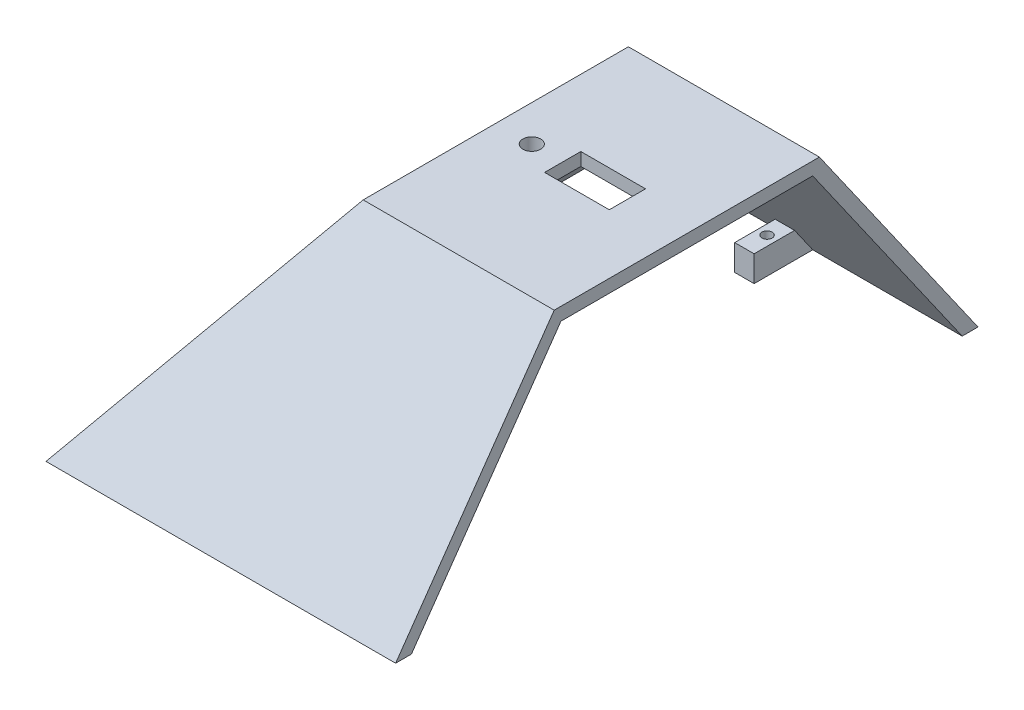
from build123d import *

# Parameters (mm, degrees)
CROQUIS1_W                        = 175.37
CROQUIS1_H                        = 180
SALIENTE_EXTRUIR1_DEPTH           = 70
CORTAR_EXTRUIR2_REACH             = 211.176
CORTAR_EXTRUIR1_REACH             = 214.105
VACIADO1_T                        = -4
CORTAR_EXTRUIR3_REACH             = 180.366
CORTAR_EXTRUIR5_REACH             = 145.836
CORTAR_EXTRUIR5_DIRECTION_2_REACH = 145.836
CORTAR_EXTRUIR8_REACH             = 145.836
CROQUIS12_W                       = 20
CROQUIS12_H                       = 11.2
CORTAR_EXTRUIR9_REACH             = 145.836
CROQUIS13_R                       = 2.75
SALIENTE_EXTRUIR2_REACH           = 194.971
CROQUIS15_W                       = 6
CROQUIS15_H                       = 8
CORTAR_EXTRUIR10_REACH            = 145.836
CROQUIS16_R                       = 1.585


with BuildPart() as part:
    # Croquis1 → Saliente-Extruir1 (new body)
    with BuildSketch(Plane(origin=(0, 0, 0), x_dir=(1, 0, 0), z_dir=(0, 1, 0))):
        Rectangle(CROQUIS1_W, CROQUIS1_H)
    extrude(amount=SALIENTE_EXTRUIR1_DEPTH)

    # Croquis3 → Cortar-Extruir2 (cut, up to next)
    with BuildSketch(Plane.ZY.offset(87.685), mode=Mode.PRIVATE) as cortar_extruir2_sk1:
        Polygon((-90, 0), (-90, 70), (-40.985472325, 70), align=None)
    cortar_extruir2_tool1 = extrude(cortar_extruir2_sk1.sketch, amount=-CORTAR_EXTRUIR2_REACH, mode=Mode.PRIVATE) & part.part
    # Croquis3 → Cortar-Extruir2 (cut, up to next)
    with BuildSketch(Plane.ZY.offset(87.685), mode=Mode.PRIVATE) as cortar_extruir2_sk2:
        Polygon((90, 0), (90, 70), (40.985472325, 70), align=None)
    cortar_extruir2_tool2 = extrude(cortar_extruir2_sk2.sketch, amount=-CORTAR_EXTRUIR2_REACH, mode=Mode.PRIVATE) & part.part
    add(cortar_extruir2_tool1.solids().sort_by_distance((-87.685, 46.666667, -73.661824))[0], mode=Mode.SUBTRACT)
    add(cortar_extruir2_tool2.solids().sort_by_distance((-87.685, 46.666667, 73.661824))[0], mode=Mode.SUBTRACT)

    # Croquis2 → Cortar-Extruir1 (cut, up to next)
    with BuildSketch(Plane.XY.offset(90), mode=Mode.PRIVATE) as cortar_extruir1_sk1:
        Polygon((-87.685, 70), (-38.670472325, 70), (-87.685, 0), align=None)
    cortar_extruir1_tool1 = extrude(cortar_extruir1_sk1.sketch, amount=-CORTAR_EXTRUIR1_REACH, mode=Mode.PRIVATE) & part.part
    # Croquis2 → Cortar-Extruir1 (cut, up to next)
    with BuildSketch(Plane.XY.offset(90), mode=Mode.PRIVATE) as cortar_extruir1_sk2:
        Polygon((87.685, 70), (38.670472325, 70), (87.685, 0), align=None)
    cortar_extruir1_tool2 = extrude(cortar_extruir1_sk2.sketch, amount=-CORTAR_EXTRUIR1_REACH, mode=Mode.PRIVATE) & part.part
    add(cortar_extruir1_tool1.solids().sort_by_distance((-71.346824, 46.666667, 90))[0], mode=Mode.SUBTRACT)
    add(cortar_extruir1_tool2.solids().sort_by_distance((71.346824, 46.666667, 90))[0], mode=Mode.SUBTRACT)

    # Vaciado1
    vaciado1_openings = [part.faces().sort_by_distance(p)[0] for p in [
        (0, 0, 0),
    ]]
    offset(amount=VACIADO1_T, openings=vaciado1_openings, kind=Kind.INTERSECTION)

    # Croquis4 → Cortar-Extruir3 (cut, up to next)
    with BuildSketch(Plane(origin=(60.39090645, 42.286167935, 0), x_dir=(0, 0, -1), z_dir=(0.819152044288995, 0.5735764363510417, 0)), mode=Mode.PRIVATE) as cortar_extruir3_sk1:
        Polygon((-90, -51.621879272), (-40.985472325, 33.832341942), (40.985472325, 33.832341942), (90, -51.621879272), align=None)
    cortar_extruir3_tool1 = extrude(cortar_extruir3_sk1.sketch, amount=-CORTAR_EXTRUIR3_REACH, mode=Mode.PRIVATE) & part.part
    add(cortar_extruir3_tool1.solids().sort_by_distance((68.549594, 30.634354, 0))[0], mode=Mode.SUBTRACT)

    # Croquis7 → Cortar-Extruir5 (cut, up to next)
    with BuildSketch(Plane.XY, mode=Mode.PRIVATE) as cortar_extruir5_sk1:
        Polygon((90, 0), (20.37, 0), (20.37, 70), (40.985472325, 70), align=None)
    cortar_extruir5_tool1 = extrude(cortar_extruir5_sk1.sketch, amount=-CORTAR_EXTRUIR5_REACH, mode=Mode.PRIVATE) & part.part
    add(cortar_extruir5_tool1.solids().sort_by_distance((45.149784, 28.663547, 0))[0], mode=Mode.SUBTRACT)

    # Croquis7 → Cortar-Extruir5 direction 2 (cut, up to next)
    with BuildSketch(Plane.XY, mode=Mode.PRIVATE) as cortar_extruir5_direction_2_sk1:
        Polygon((90, 0), (20.37, 0), (20.37, 70), (40.985472325, 70), align=None)
    cortar_extruir5_direction_2_tool1 = extrude(cortar_extruir5_direction_2_sk1.sketch, amount=CORTAR_EXTRUIR5_DIRECTION_2_REACH, mode=Mode.PRIVATE) & part.part
    add(cortar_extruir5_direction_2_tool1.solids().sort_by_distance((45.149784, 28.663547, 0))[0], mode=Mode.SUBTRACT)

    # Croquis12 → Cortar-Extruir8 (cut, up to next)
    with BuildSketch(Plane(origin=(0, 70, 0), x_dir=(1, 0, 0), z_dir=(0, 1, 0)), mode=Mode.PRIVATE) as cortar_extruir8_sk1:
        with Locations((-7.990472325, 0.000472325)):
            Rectangle(CROQUIS12_W, CROQUIS12_H)
    cortar_extruir8_tool1 = extrude(cortar_extruir8_sk1.sketch, amount=-CORTAR_EXTRUIR8_REACH, mode=Mode.PRIVATE) & part.part
    add(cortar_extruir8_tool1.solids().sort_by_distance((-7.990472, 70, -0.000472))[0], mode=Mode.SUBTRACT)

    # Croquis13 → Cortar-Extruir9 (cut, up to next)
    with BuildSketch(Plane(origin=(0, 70, 0), x_dir=(1, 0, 0), z_dir=(0, 1, 0)), mode=Mode.PRIVATE) as cortar_extruir9_sk1:
        with Locations((-27.546576138, 0)):
            Circle(CROQUIS13_R)
    cortar_extruir9_tool1 = extrude(cortar_extruir9_sk1.sketch, amount=-CORTAR_EXTRUIR9_REACH, mode=Mode.PRIVATE) & part.part
    add(cortar_extruir9_tool1.solids().sort_by_distance((-27.546576, 70, 0))[0], mode=Mode.SUBTRACT)

    # Croquis15 → Saliente-Extruir2 (add, up to next)
    with BuildSketch(Plane.XY.offset(67), mode=Mode.PRIVATE) as saliente_extruir2_sk1:
        with Locations((-28.829142533, 4)):
            Rectangle(CROQUIS15_W, CROQUIS15_H)
    saliente_extruir2_tool1 = extrude(saliente_extruir2_sk1.sketch, amount=SALIENTE_EXTRUIR2_REACH, mode=Mode.PRIVATE) - part.part
    saliente_extruir2 = saliente_extruir2_tool1.solids().sort_by_distance((-28.829143, 4, 67))[0]
    add(saliente_extruir2)

    # Croquis16 → Cortar-Extruir10 (cut, up to next)
    with BuildSketch(Plane(origin=(0, 0, 0), x_dir=(-1, 0, 0), z_dir=(0, -1, 0)), mode=Mode.PRIVATE) as cortar_extruir10_sk1:
        with Locations((28.829142533, -74)):
            Circle(CROQUIS16_R)
    cortar_extruir10_tool1 = extrude(cortar_extruir10_sk1.sketch, amount=-CORTAR_EXTRUIR10_REACH, mode=Mode.PRIVATE) & part.part
    cortar_extruir10 = cortar_extruir10_tool1.solids().sort_by_distance((-28.829143, 0, 74))[0]
    add(cortar_extruir10, mode=Mode.SUBTRACT)

    # Simetría1: Saliente-Extruir2, Cortar-Extruir10 across plane
    add(saliente_extruir2.mirror(Plane.XY))
    add(cortar_extruir10.mirror(Plane.XY), mode=Mode.SUBTRACT)


solid = part.part
